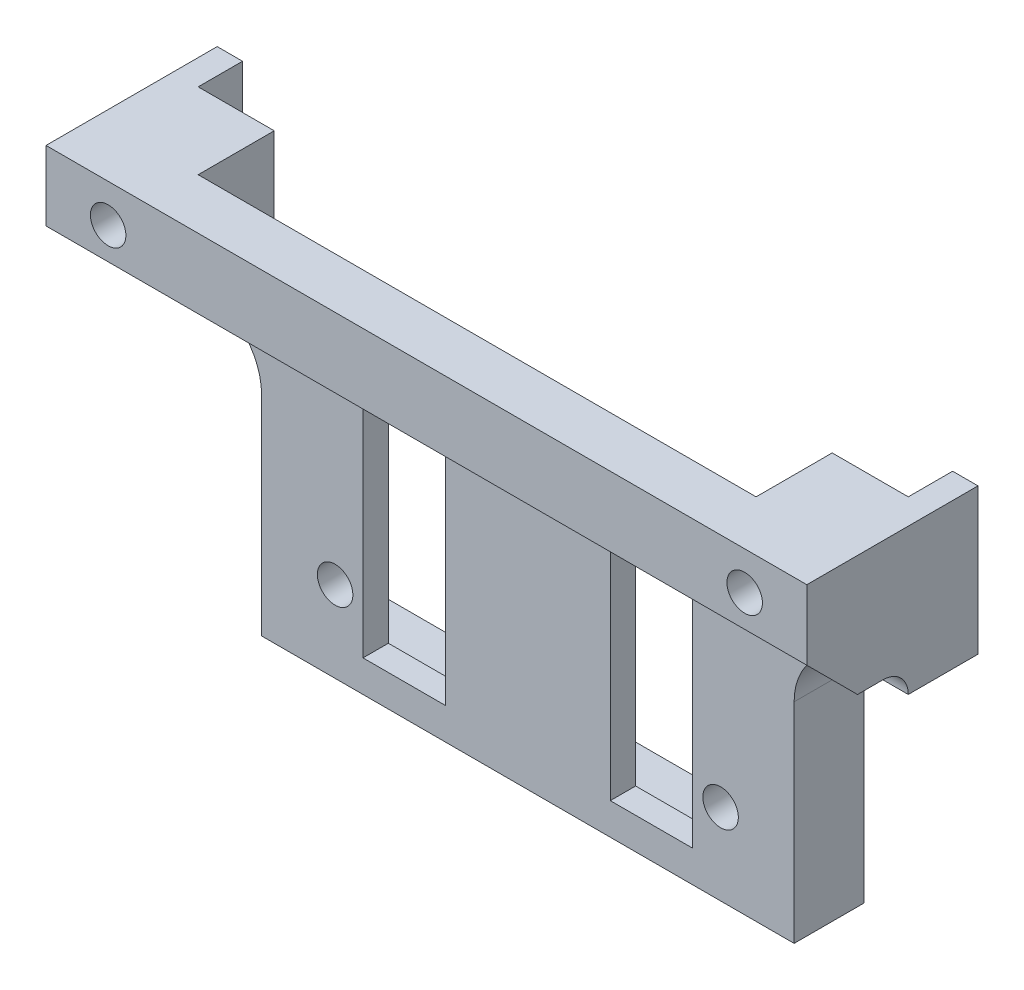
from build123d import *

# Parameters (mm, degrees)
SKETCH_1_W                 = 42
SKETCH_1_H                 = 35
EXTRUDE_1_DEPTH            = 10
SKETCH_2_W                 = 6.5
SKETCH_2_H                 = 21
CUT_EXTRUDE_1_DEPTH        = 10
SKETCH_5_W                 = 9
SKETCH_5_H                 = 11.5
EXTRUDE_2_DEPTH            = 10
SKETCH_6_R                 = 1.4
CUT_EXTRUDE_4_DEPTH        = 10
SKETCH_3_W                 = 44
SKETCH_3_H                 = 8
CUT_EXTRUDE_2_DEPTH        = 6
CUT_EXTRUDE_1_2_DEPTH      = 37.142080737
CUT_EXTRUDE_1_2_DEPTH_BACK = 10
SKETCH_8_W                 = 59.417014287
SKETCH_8_H                 = 10
EXTRUDE_3_DEPTH            = 3.5
SKETCH_12_W                = 60
SKETCH_12_H                = 23.5
CUT_EXTRUDE_5_DEPTH        = 8
FILLET_1_R                 = 5
FILLET_3_R                 = 2
CHAMFER_1_SIZE             = 4


with BuildPart() as part:
    # 草图1 → 凸台-拉伸1 (new body)
    with BuildSketch(Plane.XY):
        Rectangle(SKETCH_1_W, SKETCH_1_H)
    extrude(amount=EXTRUDE_1_DEPTH)

    # 草图2 → Cut-Extrude 1 (cut)
    with BuildSketch(Plane.XY.offset(10)):
        with Locations((-9.75, -2.5)):
            Rectangle(SKETCH_2_W, SKETCH_2_H)
        with Locations((9.75, -2.5)):
            Rectangle(SKETCH_2_W, SKETCH_2_H)
    extrude(amount=-CUT_EXTRUDE_1_DEPTH, mode=Mode.SUBTRACT)

    # 草图5 → 凸台-拉伸2 (add)
    with BuildSketch(Plane(origin=(0, 0, 0), x_dir=(-1, 0, 0), z_dir=(0, 0, -1))):
        with Locations((-25.5, 11.75)):
            Rectangle(SKETCH_5_W, SKETCH_5_H)
        with Locations((25.5, 11.75)):
            Rectangle(SKETCH_5_W, SKETCH_5_H)
    extrude(amount=-EXTRUDE_2_DEPTH)

    # 草图6 → 切除-拉伸4 (cut)
    with BuildSketch(Plane(origin=(0, 0, 0), x_dir=(-1, 0, 0), z_dir=(0, 0, -1))):
        with Locations((-25.1, 14.5)):
            Circle(SKETCH_6_R)
        with Locations((25.1, 14.5)):
            Circle(SKETCH_6_R)
        with Locations((-15.2, -9.1)):
            Circle(SKETCH_6_R)
        with Locations((15.2, -9.1)):
            Circle(SKETCH_6_R)
    extrude(amount=-CUT_EXTRUDE_4_DEPTH, mode=Mode.SUBTRACT)

    # 草图3 → 切除-拉伸2 (cut)
    with BuildSketch(Plane(origin=(0, 0, 0), x_dir=(-1, 0, 0), z_dir=(0, 0, -1))):
        with Locations((0, 13.5)):
            Rectangle(SKETCH_3_W, SKETCH_3_H)
    extrude(amount=-CUT_EXTRUDE_2_DEPTH, mode=Mode.SUBTRACT)

    # 草图8 → Cut-Extrude 1 2 (cut, two sides: drawn at the far end of the back side and taken through both)
    with BuildSketch(Plane.XY.offset(10).offset(-CUT_EXTRUDE_1_2_DEPTH_BACK)):
        with Locations((3.029489766, -20.5)):
            Rectangle(SKETCH_8_W, SKETCH_8_H)
    extrude(amount=CUT_EXTRUDE_1_2_DEPTH + CUT_EXTRUDE_1_2_DEPTH_BACK, mode=Mode.SUBTRACT)

    # 草图10 → 凸台-拉伸3 (add)
    with BuildSketch(Plane(origin=(0, 0, 0), x_dir=(-1, 0, 0), z_dir=(0, 0, -1))):
        Polygon((-28, 17.5), (-30, 17.5), (-30, 6), (-21, 6), (-21, -15.5), (0, -15.5), (0, -13.5), (-19, -13.5), (-19, 7), (-28, 7), align=None)
        Polygon((0, -13.5), (0, -15.5), (21, -15.5), (21, 6), (30, 6), (30, 17.5), (28, 17.5), (28, 7), (19, 7), (19, -13.5), align=None)
    extrude(amount=EXTRUDE_3_DEPTH)

    # 草图12 → 切除-拉伸5 (cut)
    with BuildSketch(Plane.XY.offset(10)):
        with Locations((0, -3.75)):
            Rectangle(SKETCH_12_W, SKETCH_12_H)
    extrude(amount=-CUT_EXTRUDE_5_DEPTH, mode=Mode.SUBTRACT)

    # 圆角1
    fillet_1_edges = [part.edges().sort_by_distance(p)[0] for p in [
        (-21, 6, -0.75),
        (21, 6, -0.75),
    ]]
    fillet(fillet_1_edges, radius=FILLET_1_R)

    # 圆角3
    fillet_3_edges = [part.edges().sort_by_distance(p)[0] for p in [
        (21.5, 8, 2),
        (-21.5, 8, 2),
        (0, 8, 2),
    ]]
    fillet(fillet_3_edges, radius=FILLET_3_R - 0.0001)  # a hair under: the kernel refuses the full size

    # 倒角1
    chamfer_1_edges = [part.edges().sort_by_distance(p)[0] for p in [
        (0, 8, 10),
    ]]
    chamfer(chamfer_1_edges, length=CHAMFER_1_SIZE)


solid = part.part
